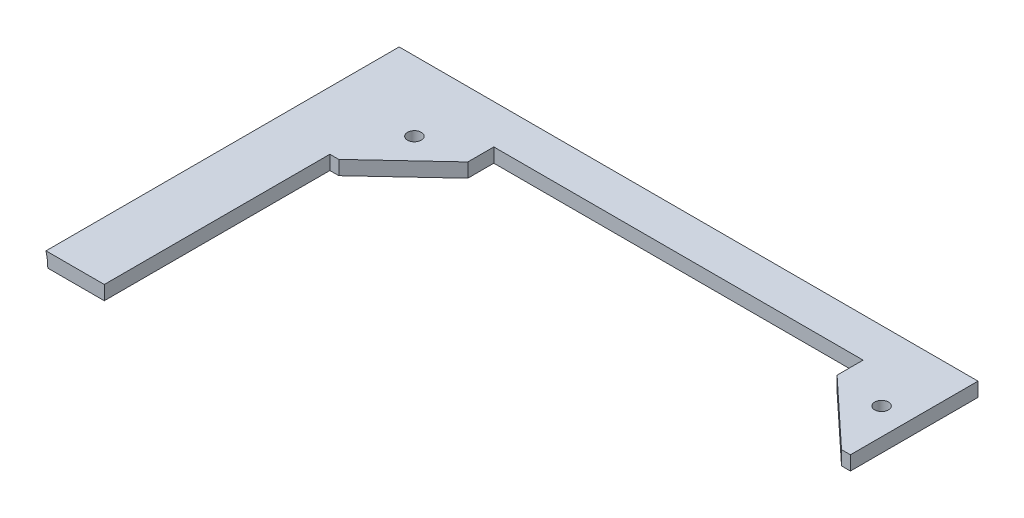
from build123d import *

# Parameters (mm, degrees)
SKETCH1_W            = 152.4
SKETCH1_H            = 76.2
BOSS_EXTRUDE1_DEPTH  = 3.175
SKETCH2_R            = 1.545336663
CUT_EXTRUDE4_DEPTH   = 86.253332046
SKETCH3_W            = 134.7
SKETCH3_H            = 3.175
BOSS_EXTRUDE2_DEPTH  = 3.175
CUT_SWEEP1_PROFILE_R = 12.7


with BuildPart() as part:
    # Sketch1 → Boss-Extrude1 (new body)
    with BuildSketch(Plane(origin=(0, 0, 0), x_dir=(1, 0, 0), z_dir=(0, 1, 0))):
        Rectangle(SKETCH1_W, SKETCH1_H)
    extrude(amount=BOSS_EXTRUDE1_DEPTH)

    # Sketch2 → Cut-Extrude4 (cut, through all)
    with BuildSketch(Plane(origin=(0, 3.175, 0), x_dir=(1, 0, 0), z_dir=(0, 1, 0))):
        Polygon((-58.5, 12.6), (-58.5, -38.1), (76.2, -38.1), (76.2, 38.1), (58.5, 38.1), (58.5, 12.6), (56.5, 12.6), (41.5, 26.6), (41.5, 32.45), (-41.5, 32.45), (-41.5, 26.6), (-56.5, 12.6), align=None)
        with Locations((-52.505245516, 25.605245516)):
            Circle(SKETCH2_R)
        with Locations((52.5, 25.605245516)):
            Circle(SKETCH2_R)
    extrude(amount=-CUT_EXTRUDE4_DEPTH, mode=Mode.SUBTRACT)

    # Sketch3 → Boss-Extrude2 (add)
    with BuildSketch(Plane(origin=(0, 0, -38.1), x_dir=(-1, 0, 0), z_dir=(0, 0, -1))):
        with Locations((8.85, 1.5875)):
            Rectangle(SKETCH3_W, SKETCH3_H)
    extrude(amount=BOSS_EXTRUDE2_DEPTH)

    # Cut-Sweep1: sweep along a curve in space
    with BuildLine() as cut_sweep1_path:
        Line((-83.9, 0, -54.083912637), (-83.9, 0, 450.454630794))
    # Cut-Sweep1 profile (on start of the path) → Cut-Sweep1 (sweep, cut)
    with BuildSketch(Plane(origin=(-83.9, 0, -54.083912637), x_dir=(0, 1, 0), z_dir=(0, 0, 1))):
        Circle(CUT_SWEEP1_PROFILE_R)
    sweep(path=cut_sweep1_path.line, mode=Mode.SUBTRACT)


solid = part.part
